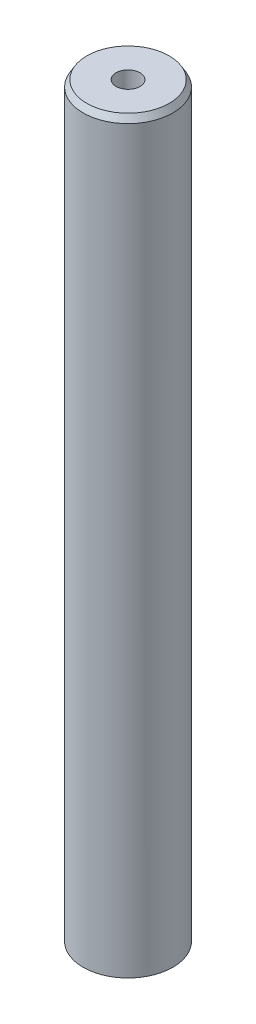
from build123d import *
from OCP.BRepFilletAPI import BRepFilletAPI_MakeChamfer

# Parameters (mm, degrees)
SKETCH1_R           = 10
BOSS_EXTRUDE1_DEPTH = 167.074365916
SKETCH2_R           = 2.66048674
CUT_EXTRUDE1_DEPTH  = 168.671833491
CHAMFER1_SIZE       = 1.427785252
CHAMFER1_SIZE2      = 0.824332199


with BuildPart() as part:
    # Sketch1 → Boss-Extrude1 (new body)
    with BuildSketch(Plane(origin=(0, 0, 0), x_dir=(1, 0, 0), z_dir=(0, 1, 0))):
        Circle(SKETCH1_R)
    extrude(amount=BOSS_EXTRUDE1_DEPTH)

    # Sketch2 → Cut-Extrude1 (cut, through all)
    with BuildSketch(Plane(origin=(0, 0, 0), x_dir=(1, 0, 0), z_dir=(0, 1, 0))):
        Circle(SKETCH2_R)
    extrude(amount=CUT_EXTRUDE1_DEPTH, mode=Mode.SUBTRACT)

    # Chamfer1: one chamfer whose edges measure the first distance from different faces: ONE call of the kernel's chamfer builder (chamfer() names one face for all edges)
    chamfer1_edges_1 = [part.edges().sort_by_distance(p)[0] for p in [
        (-10, 167.074365916, 0),
    ]]
    chamfer1_side_1 = [part.faces().sort_by_distance(p)[0] for p in [
        (-10, 83.537182958, 0),
    ]]
    chamfer1_edges_2 = [part.edges().sort_by_distance(p)[0] for p in [
        (-10, 0, 0),
    ]]
    chamfer1_side_2 = [part.faces().sort_by_distance(p)[0] for p in [
        (-9.717157288, 0, 0),
    ]]
    chamfer1 = BRepFilletAPI_MakeChamfer(part.part.solid().wrapped)
    for e in chamfer1_edges_1:
        chamfer1.Add(CHAMFER1_SIZE, CHAMFER1_SIZE2, e.wrapped, chamfer1_side_1[0].wrapped)  # the first distance lies on this face
    for e in chamfer1_edges_2:
        chamfer1.Add(CHAMFER1_SIZE, CHAMFER1_SIZE2, e.wrapped, chamfer1_side_2[0].wrapped)  # the first distance lies on this face
    add(Compound.cast(chamfer1.Shape()), mode=Mode.REPLACE)


solid = part.part
